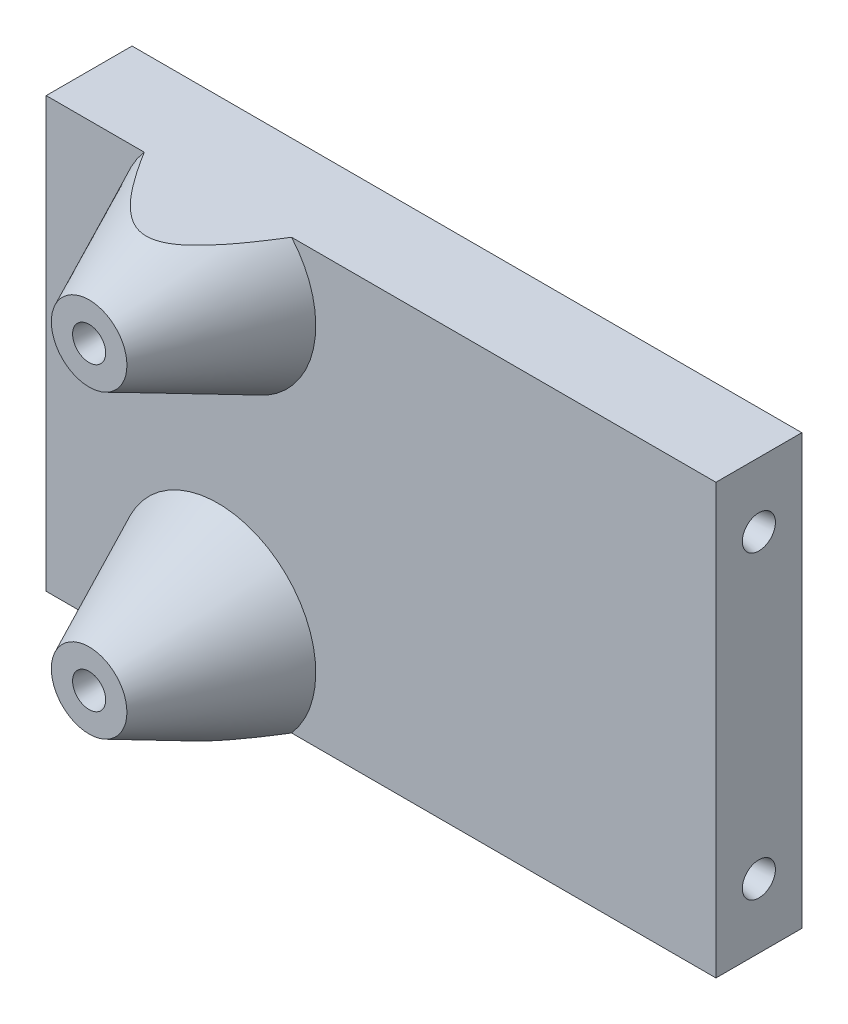
from build123d import *
from OCP.BRepFilletAPI import BRepFilletAPI_MakeChamfer

# Parameters (mm, degrees)
SKETCH1_W           = 78
SKETCH1_H           = 50
BOSS_EXTRUDE1_DEPTH = 10
SKETCH3_R           = 4.4
SKETCH3_R_2         = 1.4
BOSS_EXTRUDE2_DEPTH = 15
CUT_EXTRUDE2_START  = -5
SKETCH4_R           = 1.4
CUT_EXTRUDE2_DEPTH  = 5
SKETCH5_R           = 1.4
CUT_EXTRUDE3_DEPTH  = 35
CHAMFER1_SIZE       = 3
CHAMFER1_SIZE2      = 0.528980942
CHAMFER2_SIZE       = 6.994614872
CHAMFER2_SIZE_2     = 15
CUT_EXTRUDE4_START  = -3
CUT_EXTRUDE4_DEPTH  = 3.5
CUT_EXTRUDE5_START  = -3
CUT_EXTRUDE5_DEPTH  = 3


# Read off the part's stored shape, not the designer's step: Cut-Extrude5
with BuildPart() as part:
    # Sketch1 → Boss-Extrude1 (new body)
    with BuildSketch(Plane.XY):
        Rectangle(SKETCH1_W, SKETCH1_H)
    extrude(amount=BOSS_EXTRUDE1_DEPTH)

    # Sketch3 → Boss-Extrude2 (add)
    # profile 1 of 2: a face of its own
    with BuildSketch(Plane.XY.offset(10)):
        with Locations(Location((-19, 17.5, 0), (0, 0, 180))):
            Circle(SKETCH3_R)
        with Locations((-19, 17.5)):
            Circle(SKETCH3_R_2, mode=Mode.SUBTRACT)
    # profile 2 of 2: a face of its own
    with BuildSketch(Plane.XY.offset(10)):
        with Locations(Location((-19, -17.5, 0), (0, 0, 180))):
            Circle(SKETCH3_R)
        with Locations((-19, -17.5)):
            Circle(SKETCH3_R_2, mode=Mode.SUBTRACT)
    extrude(amount=BOSS_EXTRUDE2_DEPTH)

    # Sketch4 → Cut-Extrude2 (cut)
    with BuildSketch(Plane.XY.offset(10).offset(CUT_EXTRUDE2_START)):
        with Locations((-19, 17.5)):
            Circle(SKETCH4_R)
        with Locations((-19, -17.5)):
            Circle(SKETCH4_R)
    extrude(amount=CUT_EXTRUDE2_DEPTH, mode=Mode.SUBTRACT)

    # Sketch5 → Cut-Extrude3 (cut)
    with BuildSketch(Plane(origin=(39, 0, 0), x_dir=(0, 0, -1), z_dir=(1, 0, 0))):
        with Locations((-5, 17.5)):
            Circle(SKETCH5_R)
        with Locations((-5, -17.5)):
            Circle(SKETCH5_R)
    extrude(amount=-CUT_EXTRUDE3_DEPTH, mode=Mode.SUBTRACT)

    # Chamfer1: one chamfer whose edges measure the first distance from different faces: ONE call of the kernel's chamfer builder (chamfer() names one face for all edges)
    chamfer1_edges_1 = [part.edges().sort_by_distance(p)[0] for p in [
        (-20.4, -17.5, 25),
    ]]
    chamfer1_side_1 = [part.faces().sort_by_distance(p)[0] for p in [
        (-20.4, -17.5, 15),
    ]]
    chamfer1_edges_2 = [part.edges().sort_by_distance(p)[0] for p in [
        (-20.4, 17.5, 25),
    ]]
    chamfer1_side_2 = [part.faces().sort_by_distance(p)[0] for p in [
        (-20.4, 17.5, 15),
    ]]
    chamfer1_edges_3 = [part.edges().sort_by_distance(p)[0] for p in [
        (39, 17.5, 6.4),
    ]]
    chamfer1_side_3 = [part.faces().sort_by_distance(p)[0] for p in [
        (21.5, 17.5, 6.4),
    ]]
    chamfer1_edges_4 = [part.edges().sort_by_distance(p)[0] for p in [
        (39, -17.5, 6.4),
    ]]
    chamfer1_side_4 = [part.faces().sort_by_distance(p)[0] for p in [
        (21.5, -17.5, 6.4),
    ]]
    chamfer1 = BRepFilletAPI_MakeChamfer(part.part.solid().wrapped)
    for e in chamfer1_edges_1:
        chamfer1.Add(CHAMFER1_SIZE, CHAMFER1_SIZE2, e.wrapped, chamfer1_side_1[0].wrapped)  # the first distance lies on this face
    for e in chamfer1_edges_2:
        chamfer1.Add(CHAMFER1_SIZE, CHAMFER1_SIZE2, e.wrapped, chamfer1_side_2[0].wrapped)  # the first distance lies on this face
    for e in chamfer1_edges_3:
        chamfer1.Add(CHAMFER1_SIZE, CHAMFER1_SIZE2, e.wrapped, chamfer1_side_3[0].wrapped)  # the first distance lies on this face
    for e in chamfer1_edges_4:
        chamfer1.Add(CHAMFER1_SIZE, CHAMFER1_SIZE2, e.wrapped, chamfer1_side_4[0].wrapped)  # the first distance lies on this face
    add(Compound.cast(chamfer1.Shape()), mode=Mode.REPLACE)

    # Chamfer2
    # the kernel refuses this chamfer: 15, 6.994614872 mm, written as the material it adds along each edge
    with BuildSketch(Plane(origin=(-19, 17.5, 10), x_dir=(-1, 0, 0), z_dir=(0, 1, 0))) as chamfer2_piece_1_section:
        Polygon((4.4 + CHAMFER2_SIZE, 0), (4.4, CHAMFER2_SIZE_2), (4.4, 0), align=None)
    chamfer2_piece_1 = revolve(axis=Axis((-19, 17.5, 10), (0, 0, 1)), mode=Mode.PRIVATE)
    chamfer2_piece_1 = split(chamfer2_piece_1, bisect_by=Plane(origin=(-11.096055179, 25, 17.172081688), z_dir=(0, -1, 0)), keep=Keep.TOP, mode=Mode.PRIVATE)
    chamfer2_piece_1 = split(chamfer2_piece_1, bisect_by=Plane(origin=(-11.096055179, 17.5, 25), z_dir=(0, 0, -1)), keep=Keep.TOP, mode=Mode.PRIVATE)
    add(chamfer2_piece_1)
    with BuildSketch(Plane(origin=(-19, -17.5, 10), x_dir=(-1, 0, 0), z_dir=(0, 1, 0))) as chamfer2_piece_2_section:
        Polygon((4.4 + CHAMFER2_SIZE, 0), (4.4, CHAMFER2_SIZE_2), (4.4, 0), align=None)
    chamfer2_piece_2 = revolve(axis=Axis((-19, -17.5, 10), (0, 0, 1)), mode=Mode.PRIVATE)
    chamfer2_piece_2 = split(chamfer2_piece_2, bisect_by=Plane(origin=(-11.096055179, -25, 17.172081688), z_dir=(0, 1, 0)), keep=Keep.TOP, mode=Mode.PRIVATE)
    chamfer2_piece_2 = split(chamfer2_piece_2, bisect_by=Plane(origin=(-11.096055179, -17.5, 25), z_dir=(0, 0, -1)), keep=Keep.TOP, mode=Mode.PRIVATE)
    add(chamfer2_piece_2)

    # Sketch6 → Cut-Extrude4 (cut)
    with BuildSketch(Plane(origin=(0, 0, 0), x_dir=(-1, 0, 0), z_dir=(0, 0, -1)).offset(CUT_EXTRUDE4_START)):
        with BuildLine():
            Line((-24.75, 10), (-24.75, 0))
            ThreePointArc((-24.75, 0), (-28.5, -3.75), (-32.25, 0))
            Line((-32.25, 0), (-32.25, 10))
            ThreePointArc((-32.25, 10), (-28.5, 13.75), (-24.75, 10))
        make_face()
        with BuildLine():
            Line((24.75, 10), (24.75, 0))
            ThreePointArc((24.75, 0), (28.5, -3.75), (32.25, 0))
            Line((32.25, 0), (32.25, 10))
            ThreePointArc((32.25, 10), (28.5, 13.75), (24.75, 10))
        make_face()
    extrude(amount=-CUT_EXTRUDE4_DEPTH, mode=Mode.SUBTRACT)

    # Cut-Extrude5 outline → Cut-Extrude5 (cut)
    with BuildSketch(Plane(origin=(0, 0, 0), x_dir=(-1, 0, 0), z_dir=(0, 0, -1)).offset(CUT_EXTRUDE5_START)):
        with BuildLine():
            ThreePointArc((26.45, 4.478839135), (26.254757862, 3.41425784), (25.694444444, 2.488243964))
            ThreePointArc((25.694444444, 2.488243964), (28.5, -3.75), (31.305555556, 2.488243964))
            ThreePointArc((31.305555556, 2.488243964), (30.745242138, 3.41425784), (30.55, 4.478839135))
            Line((30.55, 4.478839135), (30.55, 10))
            ThreePointArc((30.55, 10), (28.5, 12.05), (26.45, 10))
            Line((26.45, 10), (26.45, 4.478839135))
        make_face()
        with BuildLine():
            ThreePointArc((-25.694444444, 2.488243964), (-26.254757862, 3.41425784), (-26.45, 4.478839135))
            Line((-26.45, 4.478839135), (-26.45, 10))
            ThreePointArc((-26.45, 10), (-28.5, 12.05), (-30.55, 10))
            Line((-30.55, 10), (-30.55, 4.478839135))
            ThreePointArc((-30.55, 4.478839135), (-30.745242138, 3.41425784), (-31.305555556, 2.488243964))
            ThreePointArc((-31.305555556, 2.488243964), (-28.5, -3.75), (-25.694444444, 2.488243964))
        make_face()
    extrude(amount=CUT_EXTRUDE5_DEPTH, mode=Mode.SUBTRACT)


solid = part.part
